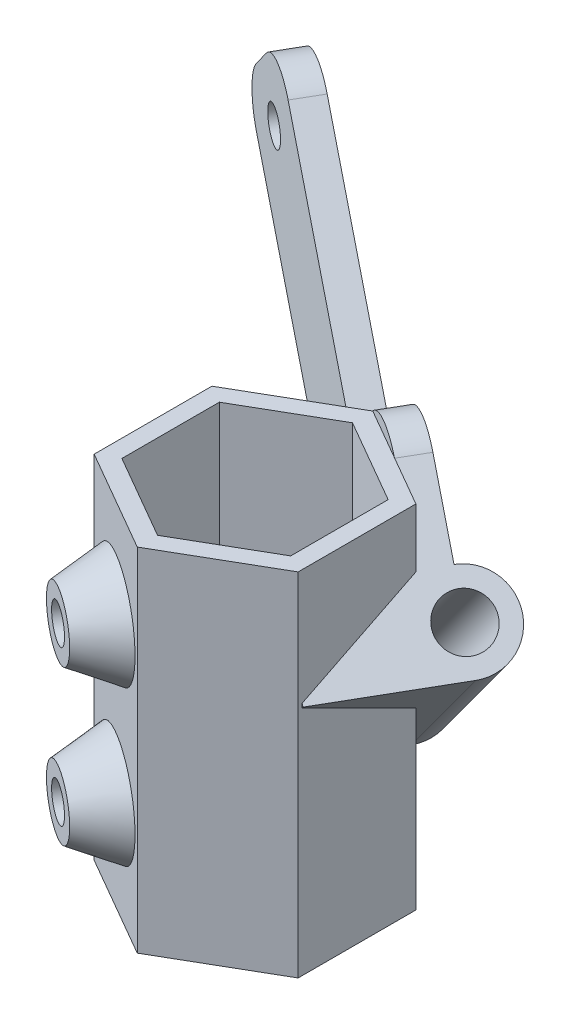
from build123d import *

# Parameters (mm, degrees)
RESSALTO_EXTRUS_O1_DEPTH      = 25
ESBO_O3_R                     = 2.25
RESSALTO_EXTRUS_O2_DEPTH      = 3
ESBO_O6_R                     = 1.25
CORTE_EXTRUS_O2_DEPTH         = 10
RESSALTO_EXTRUS_O3_DEPTH      = 5
RESSALTO_EXTRUS_O3_DEPTH_BACK = 7
CORTE_EXTRUS_O1_DEPTH         = 32.980788504
FILETE1_R                     = 3
ESBO_O9_R                     = 1.75
CORTE_EXTRUS_O3_DEPTH         = 32.199307287
RESSALTO_EXTRUS_O4_DEPTH      = 8.8
RESSALTO_EXTRUS_O5_DEPTH      = 20.2
ESBO_O14_R                    = 1.25
CORTE_EXTRUS_O4_DEPTH         = 47.082463565
FILETE2_R                     = 3
FILETE3_R                     = 3


# Some blends are built 0.0001 mm under size
with BuildPart() as part:
    # Esboço1 → Ressalto-extrusão1 (new body)
    with BuildSketch(Plane(origin=(0, 0, 0), x_dir=(1, 0, 0), z_dir=(0, 1, 0))):
        Polygon((7.25, 4.185789452), (0, 8.371578903), (-7.25, 4.185789452), (-7.25, -4.185789452), (0, -8.371578903), (7.25, -4.185789452), align=None)
    extrude(amount=RESSALTO_EXTRUS_O1_DEPTH)

    # Esboço3 → Ressalto-extrusão2 (add)
    with BuildSketch(Plane(origin=(-3.625, 0, 6.278684177), x_dir=(0.8660254037844387, 0, 0.4999999999999999), z_dir=(-0.49999999999999994, 0, 0.8660254037844388))):
        with Locations(Location((0, 7, 0), (0, 0, 180))):
            Circle(ESBO_O3_R)
        with Locations(Location((0, 18, 0), (0, 0, 180))):
            Circle(ESBO_O3_R)
    extrude(amount=RESSALTO_EXTRUS_O2_DEPTH)

    # Esboço4 → Revolução1 (revolve)
    with BuildSketch(Plane(origin=(0, 18, 0), x_dir=(1, 0, 0), z_dir=(0, 1, 0))):
        Polygon((-7.073557159, -7.751760389), (-6.872595264, -4.403684177), (-5.573557159, -5.153684177), align=None)
    revolve(axis=Axis((-2.565266445, 18, 4.443171818), (-0.5000000000000001, 0, 0.8660254037844386)))

    # Esboço5 → Revolução2 (revolve)
    with BuildSketch(Plane(origin=(0, 7, 0), x_dir=(-1, 0, 0), z_dir=(0, -1, 0)), mode=Mode.PRIVATE) as revolu_o2_sk:
        Polygon((7.073557159, -7.751760389), (5.573557159, -5.153684177), (6.872595264, -4.403684177), align=None)
    revolve(revolu_o2_sk.sketch.rotate(Axis((-5.573557159, 7, 9.653684177), (0.4999999999999998, 0, -0.8660254037844388)), 180), axis=Axis((-5.573557159, 7, 9.653684177), (0.4999999999999998, 0, -0.8660254037844388)))

    # Esboço6 → Corte-extrusão2 (cut)
    with BuildSketch(Plane(origin=(-5.125, 0, 8.876760389), x_dir=(0.8660254037844386, 0, 0.5), z_dir=(-0.5000000000000001, 0, 0.8660254037844387))):
        with Locations((0, 18)):
            Circle(ESBO_O6_R)
        with Locations(Location((0, 7, 0), (0, 0, 180))):
            Circle(ESBO_O6_R)
    extrude(amount=-CORTE_EXTRUS_O2_DEPTH, mode=Mode.SUBTRACT)

    # Esboço8 → Ressalto-extrusão3 (add, two sides: drawn at the far end of the back side and taken through both)
    with BuildSketch(Plane(origin=(3.625, 0, -6.278684177), x_dir=(-0.8660254037844386, 0, -0.4999999999999999), z_dir=(0.49999999999999994, 0, -0.8660254037844387)).offset(-RESSALTO_EXTRUS_O3_DEPTH_BACK)):
        Polygon((-4.128938216, 20.871578903), (8.371578903, 8.371061784), (4.128938216, 4.128421097), (-8.371578903, 16.628938216), align=None)
    extrude(amount=RESSALTO_EXTRUS_O3_DEPTH + RESSALTO_EXTRUS_O3_DEPTH_BACK)

    # Esboço2 → Corte-extrusão1 (cut, through all)
    with BuildSketch(Plane(origin=(0, 25, 0), x_dir=(1, 0, 0), z_dir=(0, 1, 0))):
        Polygon((0, 6.92820323), (-6, 3.464101615), (-6, -3.464101615), (0, -6.92820323), (6, -3.464101615), (6, 3.464101615), align=None)
    extrude(amount=-CORTE_EXTRUS_O1_DEPTH, mode=Mode.SUBTRACT)

    # Filete1
    filete1_edges = [part.edges().sort_by_distance(p)[0] for p in [
        (7.962117307, 10.378679656, -9.548151025),
        (4.287882693, 14.621320344, -11.669471368),
    ]]
    fillet(filete1_edges, radius=FILETE1_R - 0.0001)  # a hair under: the kernel refuses the full size

    # Esboço9 → Corte-extrusão3 (cut, through all)
    with BuildSketch(Plane(origin=(-0.000223919, -0.00025856, -0.00012928), x_dir=(0.7905694150420967, -0.547722557505165, -0.27386127875258026), z_dir=(-0.6123724356957922, -0.7071067811865502, -0.3535533905932724))):
        with Locations(Location((-0.996318298, -12.755189134, 0), (0, 0, 17.023866185))):
            Circle(ESBO_O9_R)
    extrude(amount=-CORTE_EXTRUS_O3_DEPTH, mode=Mode.SUBTRACT)

    # Esboço10 → Ressalto-extrusão4 (add)
    with BuildSketch(Plane(origin=(-7.249776081, 8.371320344, -4.185660172), x_dir=(0.7905694150420924, 0.5477225575051679, -0.2738612787525866), z_dir=(-0.6123724356957977, 0.707106781186544, -0.3535533905932755))):
        Polygon((5.849930433, 7.165250453), (4.585019369, 5.616057115), (18.278649783, -5.564745298), (19.543560847, -4.01555196), align=None)
    extrude(amount=RESSALTO_EXTRUS_O4_DEPTH)

    # Esboço13 → Ressalto-extrusão5 (add)
    with BuildSketch(Plane(origin=(-12.638653515, 14.593860018, -7.296930009), x_dir=(0.7905694150420924, 0.547722557505168, -0.27386127875258653), z_dir=(-0.6123724356957978, 0.707106781186544, -0.35355339059327534))):
        Polygon((4.585019369, 5.616057115), (5.849930433, 7.165250453), (12.69674564, 1.574849247), (11.410886615, 0), align=None)
    extrude(amount=RESSALTO_EXTRUS_O5_DEPTH)

    # Esboço14 → Corte-extrusão4 (cut, through all)
    with BuildSketch(Plane(origin=(3.641584315, 0.01920948, -6.268990093), x_dir=(0.8646985820812304, -0.0015391164783120645, 0.5022887548683287), z_dir=(-0.5022911129481685, -0.002649602595281497, 0.8646945226259835))):
        with Locations(Location((-23.342145929, 29.472416585, 0), (0, 0, 0.088185223))):
            Circle(ESBO_O14_R)
    extrude(amount=-CORTE_EXTRUS_O4_DEPTH, mode=Mode.SUBTRACT)

    # Filete2
    filete2_edges = [part.edges().sort_by_distance(p)[0] for p in [
        (-15.479198351, 35.127416998, -18.444075991),
        (-20.883800635, 28.877158438, -21.58354736),
    ]]
    fillet(filete2_edges, radius=FILETE2_R)

    # Filete3
    # the kernel refuses this fillet: 3 mm, written as the material it takes off along each edge
    with BuildSketch(Plane(origin=(1.811887952, 27.094118578, -7.325484907), x_dir=(0.6123724356957967, -0.707106781186545, 0.3535533905932749), z_dir=(0.49999999999999784, -2.3869795029440866e-15, -0.86602540378444))) as filete3_piece_1:
        with BuildLine():
            CenterArc((FILETE3_R, FILETE3_R), FILETE3_R, 180, 90)
            Line((0, FILETE3_R), (0, 0))
            Line((0, 0), (FILETE3_R, 0))
        make_face()
    extrude(amount=9.5, mode=Mode.SUBTRACT)


solid = part.part
